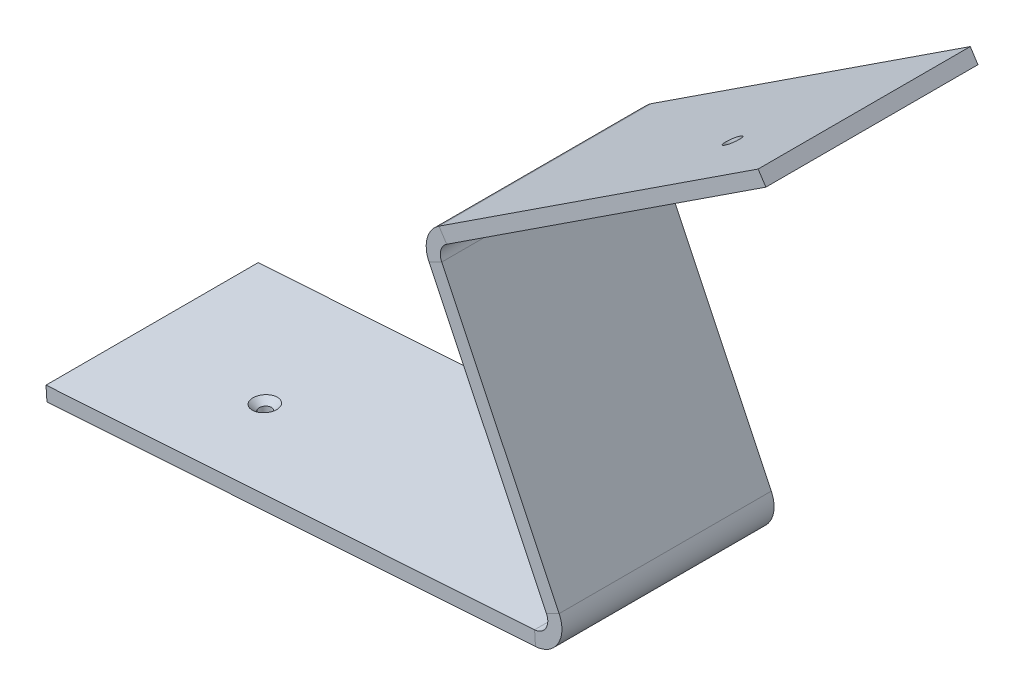
from build123d import *

# Parameters (mm, degrees)
BASE_FLANGE1_DEPTH                                   = 60
CSK_FOR_M3_HEX_SOCKET_COUNTERSUNK_CAP_SC_D           = 3.4
CSK_FOR_M3_HEX_SOCKET_COUNTERSUNK_CAP_SC_CSINK_D     = 6.72
CSK_FOR_M3_HEX_SOCKET_COUNTERSUNK_CAP_SC_CSINK_ANGLE = 90
CSK_FOR_M4_COUNTERSUNK_RAISED_HEAD_SCREW_D           = 4.5
CSK_FOR_M4_COUNTERSUNK_RAISED_HEAD_SCREW_CSINK_D     = 9.4
CSK_FOR_M4_COUNTERSUNK_RAISED_HEAD_SCREW_CSINK_ANGLE = 90


# Sheet-metal steps are written as plain solids
with BuildPart() as part:
    # Sketch1 → Base-Flange1 (new body)
    with BuildSketch(Plane.XY):
        with BuildLine():
            Line((-91.244236532, -54.615390039), (46.945285338, -45.450675325))
            ThreePointArc((46.945285338, -45.450675325), (50.13319854, -43.479214131), (50.289406158, -39.734210927))
            Line((50.289406158, -39.734210927), (17.068758356, 29.75632288))
            ThreePointArc((17.068758356, 29.75632288), (16.581579748, 35.359878725), (19.903130417, 39.899094764))
            Line((19.903130417, 39.899094764), (110.167579221, 99.019669419))
            Line((110.167579221, 99.019669419), (112.359212119, 95.673515621))
            Line((112.359212119, 95.673515621), (22.094763314, 36.552940965))
            ThreePointArc((22.094763314, 36.552940965), (20.43398798, 34.283332946), (20.677577284, 31.481555023))
            Line((20.677577284, 31.481555023), (53.898225085, -38.008978784))
            ThreePointArc((53.898225085, -38.008978784), (53.585809851, -45.498985193), (47.209983446, -49.44190758))
            Line((47.209983446, -49.44190758), (-90.979538424, -58.606622294))
            Line((-90.979538424, -58.606622294), (-91.244236532, -54.615390039))
        make_face()
    extrude(amount=BASE_FLANGE1_DEPTH)

    # CSK for M3 Hex Socket Countersunk Cap Screw1 (through all)
    with Locations(Plane(origin=(3.206660902, -48.351416347, 0), x_dir=(0.9978080636970287, 0.06617452698120734, 0), z_dir=(-0.06617452698120732, 0.9978080636970286, 0))):
        with Locations((-56.559497038, -36.126961684)):
            CounterSinkHole(CSK_FOR_M3_HEX_SOCKET_COUNTERSUNK_CAP_SC_D / 2, CSK_FOR_M3_HEX_SOCKET_COUNTERSUNK_CAP_SC_CSINK_D / 2, counter_sink_angle=CSK_FOR_M3_HEX_SOCKET_COUNTERSUNK_CAP_SC_CSINK_ANGLE)

    # CSK for M4 Countersunk Raised Head Screw1 (through all)
    with Locations(Plane(origin=(-10.120981557, 15.452570055, 0), x_dir=(-0.836538449635925, -0.5479082243229453, 0), z_dir=(0.5479082243229453, -0.836538449635925, 0))):
        with Locations((-109.792583779, -36.598273193)):
            CounterSinkHole(CSK_FOR_M4_COUNTERSUNK_RAISED_HEAD_SCREW_D / 2, CSK_FOR_M4_COUNTERSUNK_RAISED_HEAD_SCREW_CSINK_D / 2, counter_sink_angle=CSK_FOR_M4_COUNTERSUNK_RAISED_HEAD_SCREW_CSINK_ANGLE)


solid = part.part
